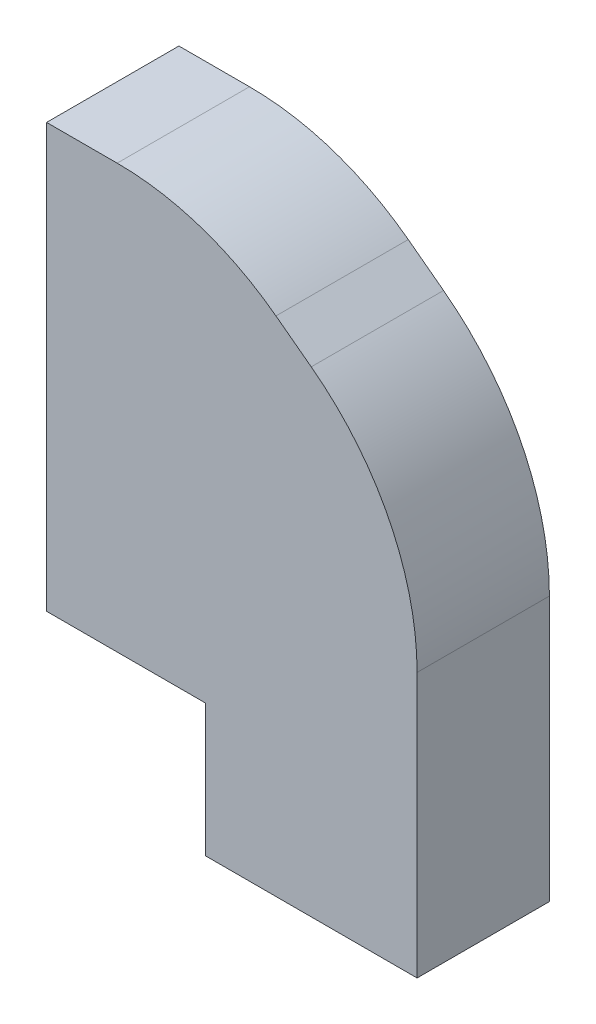
from build123d import *

# Parameters (mm, degrees)
BOSS_EXTRUDE1_DEPTH = 0.125
FILLET1_R           = 0.5


with BuildPart() as part:
    # frame_outline → Boss-Extrude1 (new, symmetric)
    with BuildSketch(Plane.XY):
        Polygon((0, 0), (0.3, 0), (0.3, -0.25), (0.7, -0.25), (0.7, -0.128713314), (0.7, 0.5), (0.3, 0.8), (0, 0.8), align=None)
    extrude(amount=BOSS_EXTRUDE1_DEPTH, both=True)

    # Fillet1
    fillet1_edges = [part.edges().sort_by_distance(p)[0] for p in [
        (0.7, 0.5, 0),
        (0.3, 0.8, 0),
    ]]
    fillet(fillet1_edges, radius=FILLET1_R)


solid = part.part
